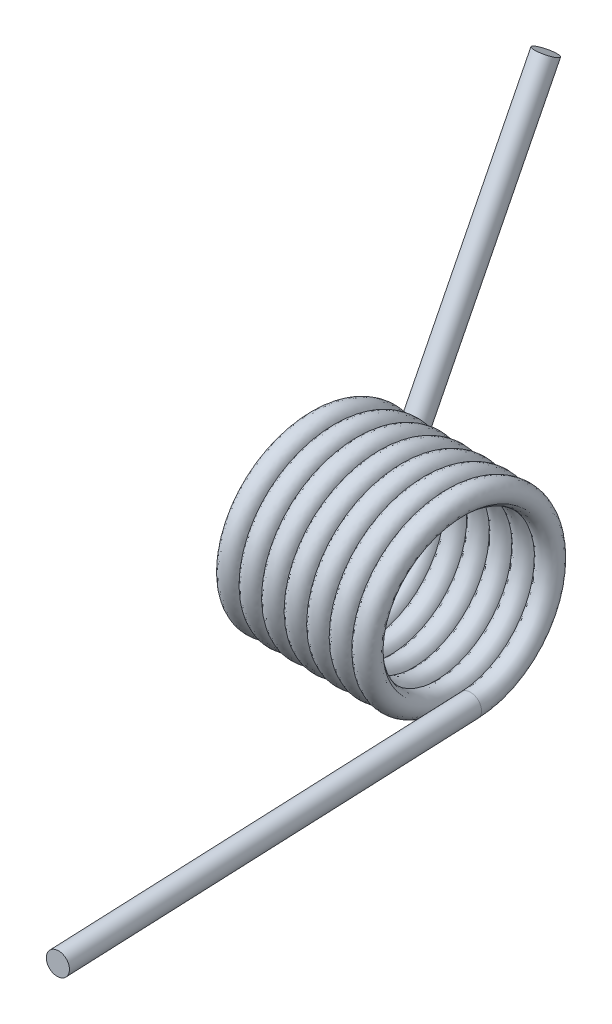
from build123d import *

# Parameters (mm, degrees)
SWEEP1_PITCH   = 2.0066
EXTRUDE1_REACH = 39.376
SKETCH3_R      = 0.9906
SKETCH4_R      = 0.9906
EXTRUDE2_DEPTH = 31.75


with BuildPart() as part:
    # Sweep1: the profile of Sketch2 screwed along a left-hand helix of 7.166667 turns, 6 arcs to a turn; built about Z, then put on its axis
    sweep1_z = Axis((0, 0, 0), (0, 0, 1))
    sweep1_corners = [(7.643738114, -0.041468514, -0.989446928), (8.610315537, 0.000994011, 0.023717294), (7.596261886, 0.041468514, 0.989446928), (6.629684463, -0.000994011, -0.023717294)]
    with BuildLine(mode=Mode.PRIVATE) as sweep1_profile:
        ThreePointArc((7.643738114, -0.041468514, -0.989446928), (8.337044213, -0.028619796, -0.682873974), (8.610315537, 0.000994011, 0.023717294))
        ThreePointArc((8.610315537, 0.000994011, 0.023717294), (8.30347345, 0.030025539, 0.716415292), (7.596261886, 0.041468514, 0.989446928))
        ThreePointArc((7.596261886, 0.041468514, 0.989446928), (6.902955787, 0.028619796, 0.682873974), (6.629684463, -0.000994011, -0.023717294))
        ThreePointArc((6.629684463, -0.000994011, -0.023717294), (6.93652655, -0.030025539, -0.716415292), (7.643738114, -0.041468514, -0.989446928))
    sweep1_cap = Face(sweep1_profile.wire())
    sweep1_arcs = [((7.643738114, -0.041468514, -0.989446928), (8.634053651, -0.040474503, -0.965729635), (8.610315537, 0.000994011, 0.023717294), (1, 0.7071067811865476, 1)), ((8.610315537, 0.000994011, 0.023717294), (8.586577422, 0.042462525, 1.013164222), (7.596261886, 0.041468514, 0.989446928), (1, 0.7071067811865476, 1)), ((7.596261886, 0.041468514, 0.989446928), (6.605946349, 0.040474503, 0.965729635), (6.629684463, -0.000994011, -0.023717294), (1, 0.7071067811865476, 1)), ((6.629684463, -0.000994011, -0.023717294), (6.653422578, -0.042462525, -1.013164222), (7.643738114, -0.041468514, -0.989446928), (1, 0.7071067811865476, 1))]  # start, shoulder, end, weights
    sweep1_turn_angles = [0, -30, -60, -90, -120, -150, -180, -210, -240, -270, -300, -330, -360]
    sweep1_turn_weights = [1, 0.8660254037844387, 1, 0.8660254037844387, 1, 0.8660254037844387, 1, 0.8660254037844387, 1, 0.8660254037844387, 1, 0.8660254037844387, 1]
    sweep1_turn_sides = [Face.make_bezier_surface([[Vector(p[j][0], p[j][1], 0).rotate(sweep1_z, sweep1_turn_angles[2 * i + k]) / sweep1_turn_weights[2 * i + k] + Vector(0, 0, p[j][2] + -SWEEP1_PITCH * sweep1_turn_angles[2 * i + k] / 360) for k in range(3)] for j in range(3)], [[p[3][j] * sweep1_turn_weights[2 * i + k] for k in range(3)] for j in range(3)]) for p in sweep1_arcs for i in range(6)]
    sweep1_last_angles = [-2520, -2550, -2580]
    sweep1_last_weights = [1, 0.8660254037844367, 1]
    sweep1_last_sides = [Face.make_bezier_surface([[Vector(p[j][0], p[j][1], 0).rotate(sweep1_z, sweep1_last_angles[2 * i + k]) / sweep1_last_weights[2 * i + k] + Vector(0, 0, p[j][2] + -SWEEP1_PITCH * sweep1_last_angles[2 * i + k] / 360) for k in range(3)] for j in range(3)], [[p[3][j] * sweep1_last_weights[2 * i + k] for k in range(3)] for j in range(3)]) for p in sweep1_arcs for i in range(1)]
    sweep1 = Plane(origin=(0, 0, 0), x_dir=(0, -1, 0), z_dir=(-1, 0, 0)) * Solid(Shell([*[p.moved(Location((0, 0, SWEEP1_PITCH * i))) for i in range(7) for p in sweep1_turn_sides], *sweep1_last_sides, sweep1_cap, sweep1_cap.rotate(sweep1_z, -2580).moved(Location((0, 0, -SWEEP1_PITCH * -2580 / 360)))]))
    add(sweep1)

    # Extrude1: up to this plane
    extrude1_end = Plane(origin=(21.266235905, -18.128983455, 37.785889758), z_dir=(0.04121237343113595, 0.026771146899025766, 0.9987916929820169))
    # Sketch3 → Extrude1 (add, up to the surface)
    with BuildSketch(Plane(origin=(0, 0, 0), x_dir=(-0.9988359867537671, 0.023963370011189408, 0.041862016952549166), z_dir=(0.04187404161884961, -1.0432626984524518e-14, 0.9991228976649985)), mode=Mode.PRIVATE) as extrude1_sk1:
        with Locations(Location((-0.182600879, 7.61781182, 0), (0, 0, 1.373131404))):
            Circle(SKETCH3_R)
    extrude1_tool1 = split(extrude(extrude1_sk1.sketch, amount=EXTRUDE1_REACH, mode=Mode.PRIVATE), bisect_by=extrude1_end, keep=Keep.BOTH, mode=Mode.PRIVATE)
    add(extrude1_tool1.solids().sort_by_distance((0, -7.62, 0))[0])

    # Sketch4 → Extrude2 (add)
    with BuildSketch(Plane(origin=(-0.025215511, 0.521041646, -0.300823535), x_dir=(0.9991228976649984, 0.03626398380105235, -0.02093702080942183), z_dir=(-0.04187404161884962, 0.8652658108806657, -0.49956144883240045))):
        with Locations(Location((-14.368020046, 7.62, 0), (0, 0, 90))):
            Circle(SKETCH4_R)
    extrude(amount=EXTRUDE2_DEPTH)


solid = part.part
